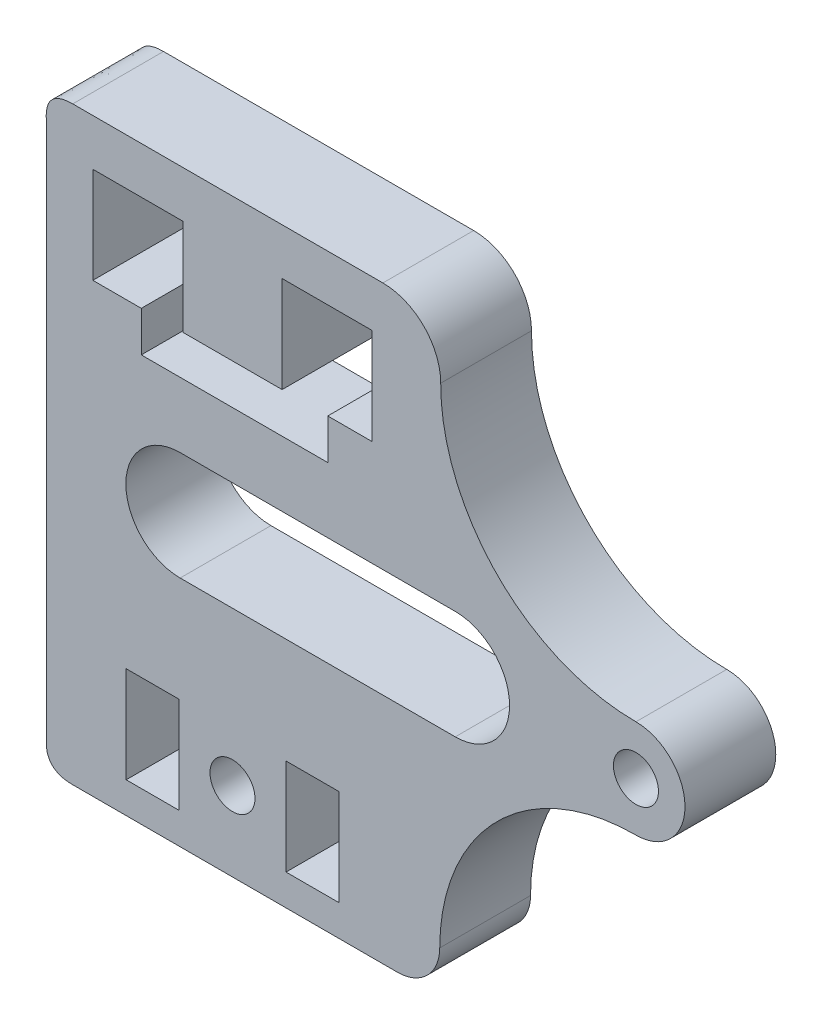
from build123d import *

# Parameters (mm, degrees)
SKETCH1_R           = 1.449961854
SKETCH1_R_2         = 1.45
SKETCH1_W           = 3.400011
SKETCH1_H           = 6.199989
BOSS_EXTRUDE2_DEPTH = 5.85


with BuildPart() as part:
    # Sketch1 → Boss-Extrude2 (new body)
    with BuildSketch(Plane.XY):
        with BuildLine():
            Line((389.265872387, 564.138903138), (409.252716514, 564.138903138))
            ThreePointArc((409.252716514, 564.138903138), (411.889085554, 563.045366847), (412.977443209, 560.406855724))
            ThreePointArc((412.977443209, 560.406855724), (416.653762554, 551.494335626), (425.559046996, 547.80052358))
            ThreePointArc((425.559046996, 547.80052358), (428.720667438, 544.638903138), (425.559046996, 541.477282695))
            ThreePointArc((425.559046996, 541.477282695), (416.627471899, 537.782838644), (412.915497767, 528.858534829))
            ThreePointArc((412.915497767, 528.858534829), (412.115481586, 526.935141182), (410.19052081, 526.138903138))
            Line((410.19052081, 526.138903138), (389.265871713, 526.138903138))
            add(Edge.make_bspline(
                [(387.560996, 527.842035377), (387.467163743, 526.138903138), (389.265871713, 526.138903138)],
                knots=[0, 0, 0, 1, 1, 1], degree=2))
            Line((387.560996, 527.842035377), (387.560996, 562.435769381))
            add(Edge.make_bspline(
                [(387.560996, 562.435769381), (387.467162762, 564.138903138), (389.265872387, 564.138903138)],
                knots=[0, 0, 0, 1, 1, 1], degree=2))
        make_face()
        with Locations((425.559046996, 544.638903138)):
            Circle(SKETCH1_R, mode=Mode.SUBTRACT)
        with Locations((399.559046996, 531.238897638)):
            Circle(SKETCH1_R_2, mode=Mode.SUBTRACT)
        Polygon((405.698755359, 552.338914138), (405.698755359, 554.938914138), (408.557097991, 554.938914138), (408.557097991, 561.138903138), (402.757097991, 561.138903138), (402.757097991, 554.938914138), (396.360996, 554.938914138), (396.360996, 561.138903138), (390.560996, 561.138903138), (390.560996, 554.938914138), (393.683007359, 554.938914138), (393.683007359, 552.338914138), align=None, mode=Mode.SUBTRACT)
        with Locations((394.409041496, 531.238897638)):
            Rectangle(SKETCH1_W, SKETCH1_H, mode=Mode.SUBTRACT)
        with Locations((404.709052496, 531.238897638)):
            Rectangle(SKETCH1_W, SKETCH1_H, mode=Mode.SUBTRACT)
        with BuildLine():
            Line((396.188262357, 548.138903138), (413.915690223, 548.138903138))
            ThreePointArc((413.915690223, 548.138903138), (417.415690223, 544.638903138), (413.915690223, 541.138903138))
            Line((413.915690223, 541.138903138), (396.188262357, 541.138903138))
            ThreePointArc((396.188262357, 541.138903138), (392.688262357, 544.638903138), (396.188262357, 548.138903138))
        make_face(mode=Mode.SUBTRACT)
    extrude(amount=BOSS_EXTRUDE2_DEPTH)


solid = part.part
